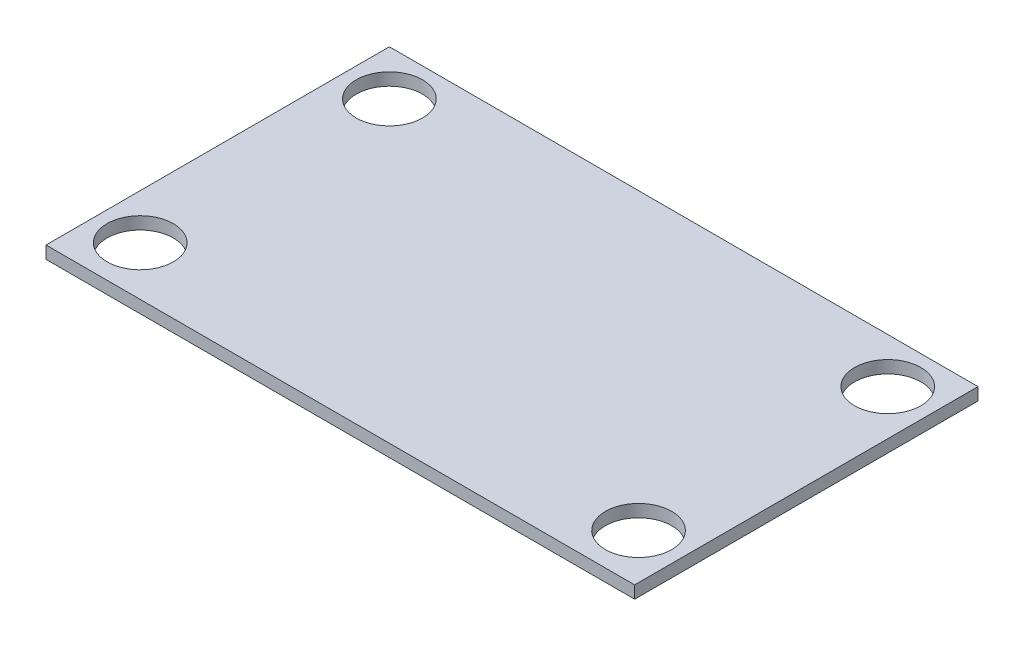
from build123d import *

# Parameters (mm, degrees)
SKETCH1_W           = 60
SKETCH1_H           = 35
SKETCH1_R           = 3.3782
BOSS_EXTRUDE1_DEPTH = 1.27


with BuildPart() as part:
    # Sketch1 → Boss-Extrude1 (new body)
    with BuildSketch(Plane(origin=(0, 0, 0), x_dir=(1, 0, 0), z_dir=(0, 1, 0))):
        with Locations((30, 17.5)):
            Rectangle(SKETCH1_W, SKETCH1_H)
        with Locations((4.6, 30.4)):
            Circle(SKETCH1_R, mode=Mode.SUBTRACT)
        with Locations((55.4, 30.4)):
            Circle(SKETCH1_R, mode=Mode.SUBTRACT)
        with Locations((4.6, 5)):
            Circle(SKETCH1_R, mode=Mode.SUBTRACT)
        with Locations((55.4, 5)):
            Circle(SKETCH1_R, mode=Mode.SUBTRACT)
    extrude(amount=BOSS_EXTRUDE1_DEPTH)


solid = part.part
